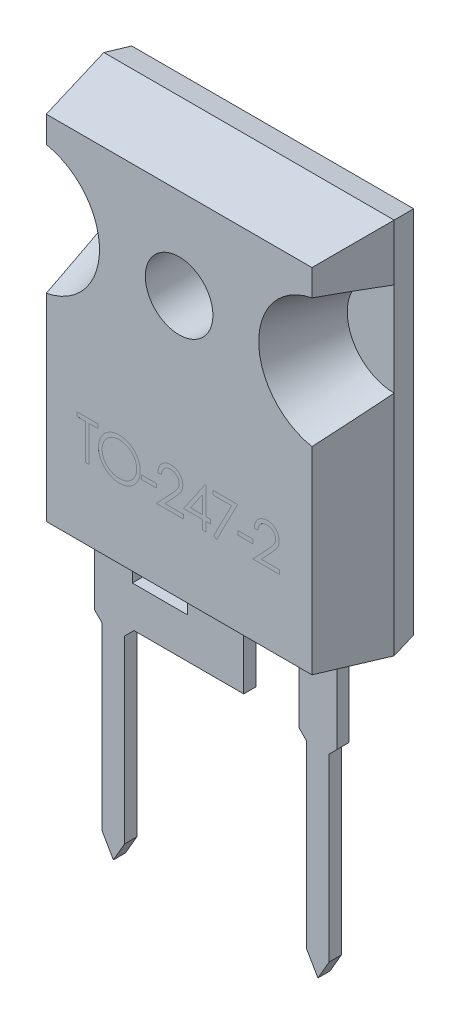
from build123d import *

# Parameters (mm, degrees)
SKETCH1_W                     = 15.5
SKETCH1_H                     = 20.15
BOSS_EXTRUDE1_DEPTH           = 1.27
BOSS_EXTRUDE1_TAPER           = 10
BOSS_EXTRUDE1_OTHER_WAY_DEPTH = 3.73
BOSS_EXTRUDE1_OTHER_WAY_TAPER = 10
SKETCH2_R                     = 2.5
CUT_EXTRUDE1_DEPTH            = 3.73
CUT_EXTRUDE1_DRAFT            = -15
CUT_EXTRUDE1_PROFILE_2_DEPTH  = 3.73
CUT_EXTRUDE1_PROFILE_2_DRAFT  = -15
CUT_EXTRUDE2_DEPTH            = 14.246925249
CUT_EXTRUDE2_DEPTH_BACK       = 14.246925249
SKETCH4_R                     = 1.805
SKETCH5_W                     = 2.02
SKETCH5_H                     = 0.65
SKETCH5_W_2                   = 3
BOSS_EXTRUDE2_DEPTH           = 14.07
SKETCH6_W                     = 7.97
SKETCH6_H                     = 2.154431013
BOSS_EXTRUDE3_DEPTH           = 0.65
SKETCH7_R                     = 1.805
BOSS_EXTRUDE4_DEPTH           = 0.0001
BOSS_EXTRUDE5_DEPTH           = 0.65
CHAMFER1_SIZE                 = 0.5
SKETCH9_W                     = 0.814102564
SKETCH9_H                     = 0.217094017
CUT_EXTRUDE3_DEPTH            = 0.0001


with BuildPart() as part:
    # Sketch1 → Boss-Extrude1 (new body)
    with BuildSketch(Plane.XY):
        Rectangle(SKETCH1_W, SKETCH1_H)
    extrude(amount=-BOSS_EXTRUDE1_DEPTH, taper=BOSS_EXTRUDE1_TAPER)

    # Sketch1 → Boss-Extrude1 other way (add)
    with BuildSketch(Plane.XY):
        Rectangle(SKETCH1_W, SKETCH1_H)
    extrude(amount=BOSS_EXTRUDE1_OTHER_WAY_DEPTH, taper=BOSS_EXTRUDE1_OTHER_WAY_TAPER)


with BuildPart() as cut_extrude1_tool:
    # Sketch2 → Cut-Extrude1 (with draft: the straight prism first)
    with BuildSketch(Plane.XY):
        with Locations((-7.75, 4.575)):
            Circle(SKETCH2_R)
    extrude(amount=CUT_EXTRUDE1_DEPTH)
    # Cut-Extrude1: the draft: its side faces are tilted about the plane it starts from
    cut_extrude1_sides = [cut_extrude1_tool.faces().sort_by_distance(p)[0] for p in [
        (-10.25, 4.575, 1.865),
    ]]
    draft(cut_extrude1_sides, Plane.XY, CUT_EXTRUDE1_DRAFT)


with BuildPart() as part_1:
    add(part.part)

    # Cut-Extrude1: cut by cut_extrude1_tool
    add(cut_extrude1_tool.part, mode=Mode.SUBTRACT)


with BuildPart() as cut_extrude1_profile_2_tool:
    # Sketch2 → Cut-Extrude1 profile 2 (with draft: the straight prism first)
    with BuildSketch(Plane.XY):
        with Locations((7.75, 4.575)):
            Circle(SKETCH2_R)
    extrude(amount=CUT_EXTRUDE1_PROFILE_2_DEPTH)
    # Cut-Extrude1 profile 2: the draft: its side faces are tilted about the plane it starts from
    cut_extrude1_profile_2_sides = [cut_extrude1_profile_2_tool.faces().sort_by_distance(p)[0] for p in [
        (5.25, 4.575, 1.865),
    ]]
    draft(cut_extrude1_profile_2_sides, Plane.XY, CUT_EXTRUDE1_PROFILE_2_DRAFT)


with BuildPart() as part_2:
    add(part_1.part)

    # Cut-Extrude1 profile 2: cut by cut_extrude1_profile_2_tool
    add(cut_extrude1_profile_2_tool.part, mode=Mode.SUBTRACT)

    # Sketch4 → Cut-Extrude2 (cut, two sides: drawn at the far end of the back side and taken through both)
    with BuildSketch(Plane.XY.offset(-CUT_EXTRUDE2_DEPTH_BACK)):
        with Locations(Location((0, 4.565, 0), (0, 0, 180))):
            Circle(SKETCH4_R)
    extrude(amount=CUT_EXTRUDE2_DEPTH + CUT_EXTRUDE2_DEPTH_BACK, mode=Mode.SUBTRACT)

    # Sketch5 → Boss-Extrude2 (add)
    with BuildSketch(Plane(origin=(0, 0, 0), x_dir=(1, 0, 0), z_dir=(0, 1, 0))):
        with Locations((-5.46, -1.455)):
            Rectangle(SKETCH5_W, SKETCH5_H)
        with Locations((5.46, -1.455)):
            Rectangle(SKETCH5_W, SKETCH5_H)
        with Locations((0, -1.455)):
            Rectangle(SKETCH5_W_2, SKETCH5_H)
    extrude(amount=-BOSS_EXTRUDE2_DEPTH)

    # Sketch6 → Boss-Extrude3 (add)
    with BuildSketch(Plane.XY.offset(1.78)):
        with Locations((-2.485, -12.992784494)):
            Rectangle(SKETCH6_W, SKETCH6_H)
    extrude(amount=-BOSS_EXTRUDE3_DEPTH)

    # Sketch7 → Boss-Extrude4 (add)
    with BuildSketch(Plane(origin=(0, 0, -1.27), x_dir=(-1, 0, 0), z_dir=(0, 0, -1))):
        with BuildLine():
            Line((-5.9, 9.225), (5.9, 9.225))
            ThreePointArc((5.9, 9.225), (6.607106781, 8.932106781), (6.9, 8.225))
            Line((6.9, 8.225), (6.9, -3.855))
            Line((6.9, -3.855), (-6.9, -3.855))
            Line((-6.9, -3.855), (-6.9, 8.225))
            ThreePointArc((-6.9, 8.225), (-6.607106781, 8.932106781), (-5.9, 9.225))
        make_face()
        with Locations((0, 4.565)):
            Circle(SKETCH7_R, mode=Mode.SUBTRACT)
    extrude(amount=BOSS_EXTRUDE4_DEPTH)

    # Sketch8 → Boss-Extrude5 (add)
    with BuildSketch(Plane.XY.offset(1.78)):
        Polygon((-6.06, -14.07), (-6.06, -24.185769515), (-5.46, -25.225), (-4.86, -24.185769515), (-4.86, -14.07), align=None)
        Polygon((6.06, -14.07), (6.06, -24.185769515), (5.46, -25.225), (4.86, -24.185769515), (4.86, -14.07), align=None)
    extrude(amount=-BOSS_EXTRUDE5_DEPTH)

    # Chamfer1
    # the kernel refuses this chamfer: 0.5 mm, written as the material it adds along each edge
    with BuildSketch(Plane(origin=(4.86, -14.07, 1.78), x_dir=(-0.9996219169112968, 0.027495876610585647, 0), z_dir=(0, 0, -1))) as chamfer1_piece_1_section:
        Polygon((CHAMFER1_SIZE * 0.999621916911, -CHAMFER1_SIZE * 0.0274958766106), (-CHAMFER1_SIZE * 0.0274958766106, -CHAMFER1_SIZE * 0.999621916911), (0, 0), align=None)
    chamfer1_piece_1 = extrude(amount=0.65, mode=Mode.PRIVATE)
    chamfer1_piece_1 = split(chamfer1_piece_1, bisect_by=Plane(origin=(4.45, -14.241727984, 1.455), z_dir=(1, 0, 0)), keep=Keep.TOP, mode=Mode.PRIVATE)
    add(chamfer1_piece_1)
    with BuildSketch(Plane(origin=(6.06, -14.07, 1.78), x_dir=(0.9996219169112968, 0.027495876610585647, 0), z_dir=(0, 0, -1))) as chamfer1_piece_2_section:
        Polygon((CHAMFER1_SIZE * 0.999621916911, CHAMFER1_SIZE * 0.0274958766106), (-CHAMFER1_SIZE * 0.0274958766106, CHAMFER1_SIZE * 0.999621916911), (0, 0), align=None)
    chamfer1_piece_2 = extrude(amount=0.65, mode=Mode.PRIVATE)
    chamfer1_piece_2 = split(chamfer1_piece_2, bisect_by=Plane(origin=(6.47, -14.241727984, 1.455), z_dir=(-1, 0, 0)), keep=Keep.TOP, mode=Mode.PRIVATE)
    add(chamfer1_piece_2)
    with BuildSketch(Plane(origin=(-4.86, -14.07, 1.78), x_dir=(0.9996219169112968, 0.027495876610585647, 0), z_dir=(0, 0, -1))) as chamfer1_piece_3:
        Polygon((CHAMFER1_SIZE * 0.999621916911, CHAMFER1_SIZE * 0.0274958766106), (-CHAMFER1_SIZE * 0.0274958766106, CHAMFER1_SIZE * 0.999621916911), (0, 0), align=None)
    extrude(amount=0.65)
    with BuildSketch(Plane(origin=(-6.06, -14.07, 1.78), x_dir=(-0.9996219169112968, 0.027495876610585647, 0), z_dir=(0, 0, -1))) as chamfer1_piece_4_section:
        Polygon((CHAMFER1_SIZE * 0.999621916911, -CHAMFER1_SIZE * 0.0274958766106), (-CHAMFER1_SIZE * 0.0274958766106, -CHAMFER1_SIZE * 0.999621916911), (0, 0), align=None)
    chamfer1_piece_4 = extrude(amount=0.65, mode=Mode.PRIVATE)
    chamfer1_piece_4 = split(chamfer1_piece_4, bisect_by=Plane(origin=(-6.47, -14.241727984, 1.455), z_dir=(1, 0, 0)), keep=Keep.TOP, mode=Mode.PRIVATE)
    add(chamfer1_piece_4)

    # Sketch9 → Cut-Extrude3 (cut)
    # profile 1 of 8: a face of its own
    with BuildSketch(Plane.XY.offset(3.73)):
        Polygon((-5.451773504, -3.741015158), (-5.451773504, -3.523921141), (-4.339166667, -3.523921141), (-4.339166667, -3.741015158), (-4.800491453, -3.741015158), (-4.800491453, -5.640587807), (-4.990448718, -5.640587807), (-4.990448718, -3.741015158), align=None)
    # profile 2 of 8: a face of its own
    with BuildSketch(Plane.XY.offset(3.73)):
        with BuildLine():
            add(Edge.make_bspline(
                [(-3.202136752, -3.469647636), (-3.162943279, -3.47064034), (-3.085964063, -3.472590093), (-2.972828291, -3.487515075), (-2.864820781, -3.51333562), (-2.761061697, -3.547724186), (-2.662792135, -3.593598029), (-2.569272424, -3.649045714), (-2.480725077, -3.714648143), (-2.398343575, -3.7898982), (-2.3229558, -3.871772955), (-2.256537288, -3.959147691), (-2.200873615, -4.05149411), (-2.15516221, -4.148534707), (-2.11930067, -4.250050021), (-2.094554391, -4.356581251), (-2.078747034, -4.467438154), (-2.076899016, -4.543049639), (-2.075961538, -4.58140645)],
                knots=[0, 0, 0, 0, 1.065120563, 2.091984664, 3.0946048, 4.079830382, 5.057816894, 6.036188127, 7.030412546, 8.04752943, 9.064399622, 10.05169764, 11.02544977, 11.989514704, 12.962713494, 13.945757189, 14.957906945, 16, 16, 16, 16], degree=3))
            add(Edge.make_bspline(
                [(-2.075961538, -4.58140645), (-2.076898879, -4.619480716), (-2.078746485, -4.694529503), (-2.094572364, -4.804682919), (-2.119392398, -4.910571102), (-2.154829187, -5.012017283), (-2.200322691, -5.109128476), (-2.256357009, -5.201649158), (-2.322361455, -5.289609659), (-2.397477027, -5.372046366), (-2.479362419, -5.447640075), (-2.567192152, -5.513510062), (-2.658990969, -5.570190842), (-2.755940174, -5.615417159), (-2.856754005, -5.651564939), (-2.962334744, -5.676210577), (-3.07218766, -5.69210798), (-3.147100124, -5.693933463), (-3.185176282, -5.694861311)],
                knots=[0, 0, 0, 0, 1.043624062, 2.057103931, 3.04512605, 4.022047818, 4.998200453, 5.980619268, 6.982898556, 8.009068085, 9.034988726, 10.034168286, 11.015286542, 11.987931943, 12.962482838, 13.94673481, 14.956375938, 16, 16, 16, 16], degree=3))
            add(Edge.make_bspline(
                [(-3.185176282, -5.694861311), (-3.223532894, -5.693924301), (-3.299143987, -5.692077205), (-3.410140194, -5.676243689), (-3.516746258, -5.651483948), (-3.618657318, -5.61609967), (-3.715930204, -5.570369249), (-3.808755159, -5.514607553), (-3.896759595, -5.448442282), (-3.97921389, -5.373351068), (-4.054657452, -5.291604463), (-4.120430979, -5.204014223), (-4.176205215, -5.11229878), (-4.221782087, -5.016203611), (-4.257864879, -4.916193262), (-4.282481603, -4.811600611), (-4.298408583, -4.703021958), (-4.300243943, -4.62909411), (-4.301175214, -4.591582732)],
                knots=[0, 0, 0, 0, 1.053102029, 2.075944431, 3.073151272, 4.055350789, 5.033113405, 6.020478099, 7.024410459, 8.052272461, 9.079885166, 10.07527673, 11.055994387, 12.023226415, 12.992069828, 13.970394897, 14.97016774, 16, 16, 16, 16], degree=3))
            add(Edge.make_bspline(
                [(-4.301175214, -4.591582732), (-4.300851886, -4.56640488), (-4.300209311, -4.516366805), (-4.292473383, -4.442061766), (-4.281247973, -4.368951702), (-4.26516015, -4.297244509), (-4.244119475, -4.227115723), (-4.219292773, -4.158081691), (-4.188970104, -4.09084201), (-4.154691808, -4.025078149), (-4.116433476, -3.961815273), (-4.074175285, -3.902016668), (-4.029401514, -3.845180541), (-3.980316986, -3.792779734), (-3.928539421, -3.743289856), (-3.873228878, -3.697471451), (-3.814722854, -3.654911362), (-3.752769606, -3.616557156), (-3.688895696, -3.581868536), (-3.623051169, -3.552101036), (-3.55613029, -3.526552227), (-3.487819622, -3.505844681), (-3.418300565, -3.489496735), (-3.34742139, -3.478364669), (-3.275238566, -3.47060901), (-3.226608863, -3.469969473), (-3.202136752, -3.469647636)],
                knots=[0, 0, 0, 0, 1.037015668, 2.060948919, 3.074880161, 4.083647147, 5.086022904, 6.090072063, 7.104153813, 8.122640571, 9.144368836, 10.147691507, 11.138137339, 12.123020368, 13.103399296, 14.087645067, 15.080126199, 16.082011238, 17.087798457, 18.072939717, 19.057185487, 20.037253025, 21.01195951, 21.997135196, 22.992090687, 24, 24, 24, 24], degree=3))
        make_face()
        with BuildLine():
            add(Edge.make_bspline(
                [(-3.192808494, -3.686741653), (-3.212895439, -3.686986516), (-3.252877296, -3.687473899), (-3.31231604, -3.693893879), (-3.370973066, -3.70304386), (-3.42886049, -3.716095541), (-3.485736103, -3.733877992), (-3.542130055, -3.754343685), (-3.597528092, -3.77927263), (-3.65174733, -3.807438027), (-3.704310256, -3.838612851), (-3.753908414, -3.873067205), (-3.800670203, -3.909993093), (-3.844481131, -3.94947669), (-3.885212554, -3.991719068), (-3.923666159, -4.036079827), (-3.958300621, -4.083826923), (-3.990041898, -4.133665597), (-4.018446259, -4.185530935), (-4.043704354, -4.238876899), (-4.064365445, -4.294138643), (-4.081215549, -4.350716633), (-4.095185435, -4.408521264), (-4.104035474, -4.467991039), (-4.110525997, -4.528827131), (-4.110985522, -4.569939966), (-4.111217949, -4.590734709)],
                knots=[0, 0, 0, 0, 1.008559885, 2.007477868, 2.99961109, 3.989939068, 4.984837346, 5.991145699, 7.001802488, 8.033829008, 9.059044045, 10.069351652, 11.065060232, 12.050310815, 13.029377138, 14.011219647, 14.996725999, 15.989392538, 16.977580475, 17.965360261, 18.951710183, 19.937753436, 20.929683414, 21.935841486, 22.955955122, 24, 24, 24, 24], degree=3))
            add(Edge.make_bspline(
                [(-4.111217949, -4.590734709), (-4.110446961, -4.621312814), (-4.108930189, -4.681469406), (-4.095651087, -4.769624426), (-4.075196845, -4.854344485), (-4.045045009, -4.935166021), (-4.007337733, -5.012783754), (-3.960754804, -5.086509131), (-3.905564786, -5.156362079), (-3.842873034, -5.221854932), (-3.774339778, -5.281633109), (-3.701567127, -5.334104313), (-3.625334707, -5.378500036), (-3.545443723, -5.414667865), (-3.462320687, -5.443327374), (-3.375429978, -5.462969212), (-3.285350414, -5.475896273), (-3.223948542, -5.477137702), (-3.192808494, -5.477767294)],
                knots=[0, 0, 0, 0, 1.032063989, 2.030389145, 3.003944642, 3.970395727, 4.937377036, 5.913328081, 6.909231446, 7.93887556, 8.970685674, 9.976071282, 10.964166581, 11.944589148, 12.933237628, 13.927779006, 14.949070134, 16, 16, 16, 16], degree=3))
            add(Edge.make_bspline(
                [(-3.192808494, -5.477767294), (-3.171877985, -5.477479727), (-3.130366502, -5.476909396), (-3.068623019, -5.471164958), (-3.007991881, -5.461953304), (-2.948558131, -5.448690479), (-2.890389221, -5.432091454), (-2.833242364, -5.412371542), (-2.777726255, -5.3877691), (-2.723140544, -5.360586291), (-2.670891388, -5.329598196), (-2.621013328, -5.296313219), (-2.574763569, -5.25944172), (-2.530985416, -5.220544757), (-2.490086766, -5.178838049), (-2.45234419, -5.13437582), (-2.417884777, -5.086877423), (-2.386155553, -5.037114344), (-2.357850722, -4.985107086), (-2.333189077, -4.93156771), (-2.312266664, -4.876628048), (-2.295376568, -4.82020886), (-2.282141074, -4.762417299), (-2.273021313, -4.703175985), (-2.266642019, -4.64260343), (-2.266161187, -4.601634527), (-2.265918803, -4.580982439)],
                knots=[0, 0, 0, 0, 1.047197238, 2.076906641, 3.100256066, 4.114471768, 5.12198147, 6.126382909, 7.136867548, 8.15857795, 9.17633901, 10.174870724, 11.156907918, 12.133735059, 13.104061851, 14.077631395, 15.04955518, 16.038496417, 17.029181396, 18.010275684, 18.986308667, 19.968651475, 20.955262928, 21.950658345, 22.966943676, 24, 24, 24, 24], degree=3))
            add(Edge.make_bspline(
                [(-2.265918803, -4.580982439), (-2.266161381, -4.560471634), (-2.266642579, -4.519784674), (-2.273018266, -4.45963456), (-2.282150709, -4.400819522), (-2.295311966, -4.343570461), (-2.312275631, -4.287872781), (-2.33319273, -4.233778796), (-2.357858126, -4.181086982), (-2.386165957, -4.129927574), (-2.417986002, -4.080836185), (-2.45275633, -4.033905202), (-2.491077279, -3.990015973), (-2.53185397, -3.948084991), (-2.576104934, -3.909006553), (-2.623629722, -3.872767696), (-2.673851374, -3.838493858), (-2.727026417, -3.807575066), (-2.781904903, -3.779021697), (-2.838216678, -3.754558471), (-2.8953238, -3.733771523), (-2.953081049, -3.716041739), (-3.011974564, -3.703094978), (-3.071606403, -3.693885634), (-3.131894065, -3.687476134), (-3.17243925, -3.686987257), (-3.192808494, -3.686741653)],
                knots=[0, 0, 0, 0, 1.02996197, 2.043119294, 3.035359645, 4.018872909, 4.991431989, 5.957985074, 6.929999688, 7.912076566, 8.892894881, 9.867085534, 10.843653904, 11.817741046, 12.803660682, 13.806313499, 14.818574707, 15.856120519, 16.894564902, 17.924820532, 18.937903209, 19.946497019, 20.957711757, 21.963978472, 22.977135795, 24, 24, 24, 24], degree=3))
        make_face(mode=Mode.SUBTRACT)
    # profile 3 of 8: a face of its own
    with BuildSketch(Plane.XY.offset(3.73)):
        with Locations((-1.603782051, -4.826485244)):
            Rectangle(SKETCH9_W, SKETCH9_H)
    # profile 4 of 8: a face of its own
    with BuildSketch(Plane.XY.offset(3.73)):
        with BuildLine():
            Line((-0.941645299, -4.175203192), (-1.131602564, -4.175203192))
            add(Edge.make_bspline(
                [(-1.131602564, -4.175203192), (-1.130364524, -4.150002226), (-1.127933046, -4.100508201), (-1.116546414, -4.028345648), (-1.100253598, -3.959369651), (-1.077217337, -3.894134036), (-1.048608303, -3.832061995), (-1.014300143, -3.773400081), (-0.973663862, -3.718372077), (-0.927576933, -3.667488109), (-0.877521613, -3.620808007), (-0.823512783, -3.580497455), (-0.766758885, -3.546438673), (-0.707432106, -3.517965732), (-0.644863099, -3.496593539), (-0.579619656, -3.480735691), (-0.511415131, -3.471194758), (-0.464945213, -3.470169211), (-0.441311432, -3.469647636)],
                knots=[0, 0, 0, 0, 1.10065271, 2.161652631, 3.183658789, 4.190468796, 5.17591951, 6.163126047, 7.15150782, 8.156236427, 9.156009102, 10.134482811, 11.092018607, 12.041330605, 13.001268258, 13.972401359, 14.968799086, 16, 16, 16, 16], degree=3))
            add(Edge.make_bspline(
                [(-0.441311432, -3.469647636), (-0.418101834, -3.470190988), (-0.372495805, -3.471258656), (-0.305934492, -3.480427469), (-0.242569175, -3.494787898), (-0.182523717, -3.514935793), (-0.126277192, -3.542019709), (-0.073407065, -3.574554411), (-0.023283908, -3.612182594), (0.021835433, -3.65648371), (0.063266509, -3.703777533), (0.099009302, -3.754267837), (0.129618215, -3.806416024), (0.155131716, -3.860619746), (0.173913286, -3.917389368), (0.188172488, -3.97589839), (0.1962324, -4.036752443), (0.197469394, -4.077940693), (0.198098291, -4.098881076)],
                knots=[0, 0, 0, 0, 1.111607364, 2.184268762, 3.212621178, 4.221274766, 5.211760367, 6.196651075, 7.1921475, 8.207485113, 9.220403448, 10.201281604, 11.166441695, 12.114753415, 13.065576456, 14.026450734, 14.996634279, 16, 16, 16, 16], degree=3))
            add(Edge.make_bspline(
                [(0.198098291, -4.098881076), (0.19707427, -4.12836191), (0.195044198, -4.186806229), (0.177678837, -4.272691408), (0.150557376, -4.355902667), (0.117901831, -4.422872368), (0.084958972, -4.476837386), (0.055272718, -4.52126846), (0.020520189, -4.569108434), (-0.019804426, -4.620197109), (-0.064866973, -4.674934656), (-0.115075615, -4.733288009), (-0.170788387, -4.79465427), (-0.209891385, -4.836567657), (-0.230153579, -4.858286124)],
                knots=[0, 0, 0, 0, 1.184426356, 2.348067706, 3.509069118, 4.696110526, 5.333549288, 6.050745305, 6.844228056, 7.710549037, 8.667450064, 9.695053472, 10.805634456, 12, 12, 12, 12], degree=3))
            Line((-0.230153579, -4.858286124), (-0.759744257, -5.42349379))
            Line((-0.759744257, -5.42349379), (0.225235043, -5.42349379))
            Line((0.225235043, -5.42349379), (0.225235043, -5.640587807))
            Line((0.225235043, -5.640587807), (-1.213012821, -5.640587807))
            Line((-1.213012821, -5.640587807), (-0.392126068, -4.764579527))
            add(Edge.make_bspline(
                [(-0.392126068, -4.764579527), (-0.372139965, -4.743716266), (-0.333750752, -4.70364221), (-0.27945367, -4.645135753), (-0.230686282, -4.59085865), (-0.187132906, -4.540913452), (-0.149738357, -4.494569599), (-0.116553722, -4.45332804), (-0.089965007, -4.415376539), (-0.061108554, -4.371385787), (-0.033160098, -4.317675481), (-0.009143578, -4.25203844), (0.00550064, -4.184470054), (0.007257373, -4.138809298), (0.008141026, -4.115841546)],
                knots=[0, 0, 0, 0, 1.329631726, 2.553950428, 3.673215718, 4.687767853, 5.603093632, 6.413772471, 7.123043292, 7.734684054, 8.834405432, 9.900288307, 10.943827018, 12, 12, 12, 12], degree=3))
            add(Edge.make_bspline(
                [(0.008141026, -4.115841546), (0.007756553, -4.101398987), (0.006998831, -4.072935474), (0.000311557, -4.03120342), (-0.009794321, -3.990947556), (-0.024275501, -3.952044058), (-0.043390053, -3.914884068), (-0.066657287, -3.879422354), (-0.093502707, -3.845139028), (-0.124557998, -3.812993938), (-0.158673536, -3.783553399), (-0.194713868, -3.757473595), (-0.232844169, -3.735678514), (-0.272903672, -3.717811732), (-0.314780694, -3.703796145), (-0.35855623, -3.694084528), (-0.404109326, -3.687987025), (-0.435214345, -3.687162026), (-0.451063702, -3.686741653)],
                knots=[0, 0, 0, 0, 0.991446411, 1.95395049, 2.89581595, 3.838931463, 4.798493298, 5.75982156, 6.748411868, 7.785213223, 8.824556874, 9.840280684, 10.836137867, 11.835679398, 12.848801643, 13.863922112, 14.911575587, 16, 16, 16, 16], degree=3))
            add(Edge.make_bspline(
                [(-0.451063702, -3.686741653), (-0.467616539, -3.687174078), (-0.500123578, -3.688023287), (-0.547850802, -3.69396366), (-0.593380772, -3.704211859), (-0.636828019, -3.718228229), (-0.678266054, -3.736043637), (-0.717493357, -3.758233406), (-0.754421866, -3.784711995), (-0.789121001, -3.814732713), (-0.821091122, -3.848156452), (-0.849180423, -3.885415811), (-0.873724089, -3.925830486), (-0.895138244, -3.969291428), (-0.91252859, -4.016193), (-0.925817115, -4.066368707), (-0.936332017, -4.119600686), (-0.939844789, -4.156361189), (-0.941645299, -4.175203192)],
                knots=[0, 0, 0, 0, 1.031018746, 2.02475058, 2.990194455, 3.934040569, 4.864654155, 5.795059489, 6.735614925, 7.690564532, 8.649604399, 9.611025574, 10.590972636, 11.591080095, 12.624614302, 13.701020113, 14.821632451, 16, 16, 16, 16], degree=3))
        make_face()
    # profile 5 of 8: a face of its own
    with BuildSketch(Plane.XY.offset(3.73)):
        Polygon((1.391521768, -3.469647636), (1.430106838, -3.469647636), (1.430106838, -4.935032252), (1.674337607, -4.935032252), (1.674337607, -5.152126269), (1.430106838, -5.152126269), (1.430106838, -5.640587807), (1.240149573, -5.640587807), (1.240149573, -5.152126269), (0.236089744, -5.152126269), align=None)
        Polygon((1.240149573, -4.935032252), (1.240149573, -4.015774773), (0.609220085, -4.935032252), align=None, mode=Mode.SUBTRACT)
    # profile 6 of 8: a face of its own
    with BuildSketch(Plane.XY.offset(3.73)):
        Polygon((1.820876068, -3.523921141), (3.123440171, -3.523921141), (2.010833333, -5.694861311), (1.846740785, -5.604546808), (2.802039263, -3.741015158), (1.820876068, -3.741015158), align=None)
    # profile 7 of 8: a face of its own
    with BuildSketch(Plane.XY.offset(3.73)):
        with Locations((3.541346154, -4.826485244)):
            Rectangle(SKETCH9_W, SKETCH9_H)
    # profile 8 of 8: a face of its own
    with BuildSketch(Plane.XY.offset(3.73)):
        with BuildLine():
            Line((4.203482906, -4.175203192), (4.013525641, -4.175203192))
            add(Edge.make_bspline(
                [(4.013525641, -4.175203192), (4.014763681, -4.150002226), (4.017195159, -4.100508201), (4.028581791, -4.028345648), (4.044874607, -3.959369651), (4.067910868, -3.894134036), (4.096519902, -3.832061995), (4.130828062, -3.773400081), (4.171464343, -3.718372077), (4.217551272, -3.667488109), (4.267606592, -3.620808007), (4.321615422, -3.580497455), (4.37836932, -3.546438673), (4.437696099, -3.517965732), (4.500265107, -3.496593539), (4.565508549, -3.480735691), (4.633713075, -3.471194758), (4.680182993, -3.470169211), (4.703816774, -3.469647636)],
                knots=[0, 0, 0, 0, 1.10065271, 2.161652631, 3.183658789, 4.190468796, 5.17591951, 6.163126047, 7.15150782, 8.156236427, 9.156009102, 10.134482811, 11.092018607, 12.041330605, 13.001268258, 13.972401359, 14.968799086, 16, 16, 16, 16], degree=3))
            add(Edge.make_bspline(
                [(4.703816774, -3.469647636), (4.727026371, -3.470190988), (4.7726324, -3.471258656), (4.839193714, -3.480427469), (4.90255903, -3.494787898), (4.962604489, -3.514935793), (5.018851013, -3.542019709), (5.07172114, -3.574554411), (5.121844297, -3.612182594), (5.166963638, -3.65648371), (5.208394714, -3.703777533), (5.244137507, -3.754267837), (5.27474642, -3.806416024), (5.300259922, -3.860619746), (5.319041491, -3.917389368), (5.333300693, -3.97589839), (5.341360605, -4.036752443), (5.3425976, -4.077940693), (5.343226496, -4.098881076)],
                knots=[0, 0, 0, 0, 1.111607364, 2.184268762, 3.212621178, 4.221274766, 5.211760367, 6.196651075, 7.1921475, 8.207485113, 9.220403448, 10.201281604, 11.166441695, 12.114753415, 13.065576456, 14.026450734, 14.996634279, 16, 16, 16, 16], degree=3))
            add(Edge.make_bspline(
                [(5.343226496, -4.098881076), (5.342202475, -4.12836191), (5.340172403, -4.186806229), (5.322807042, -4.272691408), (5.295685581, -4.355902667), (5.263030036, -4.422872368), (5.230087177, -4.476837386), (5.200400923, -4.52126846), (5.165648394, -4.569108434), (5.125323779, -4.620197109), (5.080261232, -4.674934656), (5.030052591, -4.733288009), (4.974339818, -4.79465427), (4.93523682, -4.836567657), (4.914974626, -4.858286124)],
                knots=[0, 0, 0, 0, 1.184426356, 2.348067706, 3.509069118, 4.696110526, 5.333549288, 6.050745305, 6.844228056, 7.710549037, 8.667450064, 9.695053472, 10.805634456, 12, 12, 12, 12], degree=3))
            Line((4.914974626, -4.858286124), (4.385383948, -5.42349379))
            Line((4.385383948, -5.42349379), (5.370363248, -5.42349379))
            Line((5.370363248, -5.42349379), (5.370363248, -5.640587807))
            Line((5.370363248, -5.640587807), (3.932115385, -5.640587807))
            Line((3.932115385, -5.640587807), (4.753002137, -4.764579527))
            add(Edge.make_bspline(
                [(4.753002137, -4.764579527), (4.77298824, -4.743716266), (4.811377453, -4.70364221), (4.865674535, -4.645135753), (4.914441924, -4.59085865), (4.957995299, -4.540913452), (4.995389848, -4.494569599), (5.028574483, -4.45332804), (5.055163198, -4.415376539), (5.084019651, -4.371385787), (5.111968107, -4.317675481), (5.135984627, -4.25203844), (5.150628845, -4.184470054), (5.152385579, -4.138809298), (5.153269231, -4.115841546)],
                knots=[0, 0, 0, 0, 1.329631726, 2.553950428, 3.673215718, 4.687767853, 5.603093632, 6.413772471, 7.123043292, 7.734684054, 8.834405432, 9.900288307, 10.943827018, 12, 12, 12, 12], degree=3))
            add(Edge.make_bspline(
                [(5.153269231, -4.115841546), (5.152884758, -4.101398987), (5.152127036, -4.072935474), (5.145439762, -4.03120342), (5.135333884, -3.990947556), (5.120852705, -3.952044058), (5.101738152, -3.914884068), (5.078470918, -3.879422354), (5.051625498, -3.845139028), (5.020570207, -3.812993938), (4.986454669, -3.783553399), (4.950414337, -3.757473595), (4.912284036, -3.735678514), (4.872224533, -3.717811732), (4.830347511, -3.703796145), (4.786571975, -3.694084528), (4.741018879, -3.687987025), (4.709913861, -3.687162026), (4.694064503, -3.686741653)],
                knots=[0, 0, 0, 0, 0.991446411, 1.95395049, 2.89581595, 3.838931463, 4.798493298, 5.75982156, 6.748411868, 7.785213223, 8.824556874, 9.840280684, 10.836137867, 11.835679398, 12.848801643, 13.863922112, 14.911575587, 16, 16, 16, 16], degree=3))
            add(Edge.make_bspline(
                [(4.694064503, -3.686741653), (4.677511666, -3.687174078), (4.645004628, -3.688023287), (4.597277403, -3.69396366), (4.551747433, -3.704211859), (4.508300187, -3.718228229), (4.466862151, -3.736043637), (4.427634849, -3.758233406), (4.390706339, -3.784711995), (4.356007204, -3.814732713), (4.324037083, -3.848156452), (4.295947782, -3.885415811), (4.271404116, -3.925830486), (4.249989961, -3.969291428), (4.232599615, -4.016193), (4.219311091, -4.066368707), (4.208796188, -4.119600686), (4.205283416, -4.156361189), (4.203482906, -4.175203192)],
                knots=[0, 0, 0, 0, 1.031018746, 2.02475058, 2.990194455, 3.934040569, 4.864654155, 5.795059489, 6.735614925, 7.690564532, 8.649604399, 9.611025574, 10.590972636, 11.591080095, 12.624614302, 13.701020113, 14.821632451, 16, 16, 16, 16], degree=3))
        make_face()
    extrude(amount=-CUT_EXTRUDE3_DEPTH, mode=Mode.SUBTRACT)


solid = part_2.part
